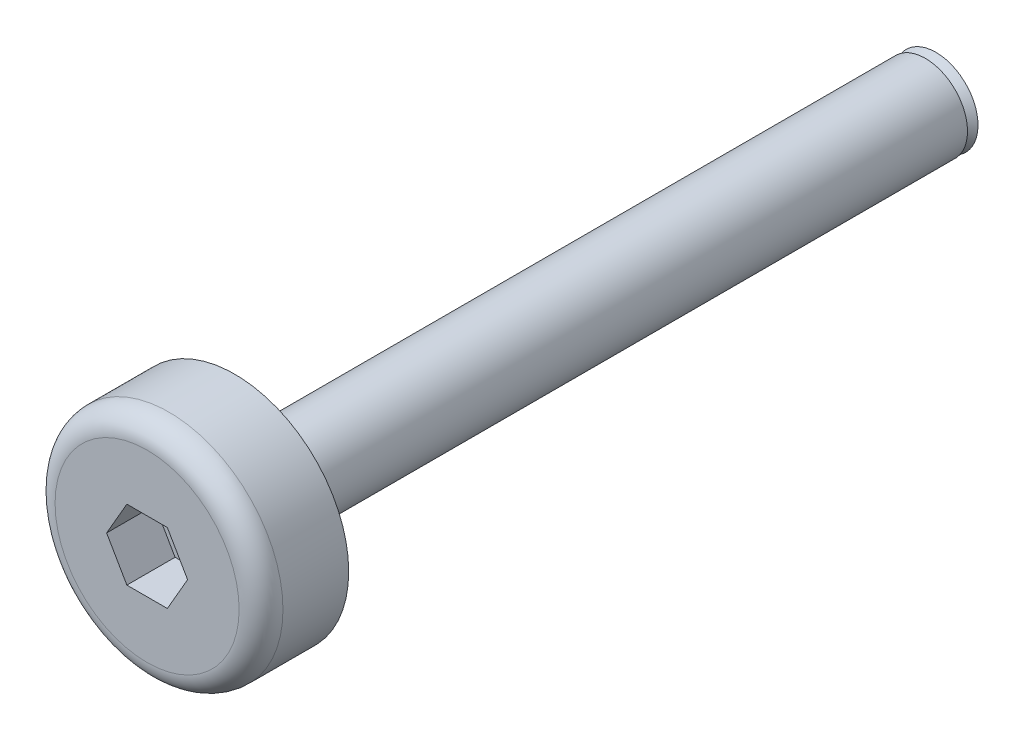
from build123d import *

# Parameters (mm, degrees)
F_0090_CYLINDER_SKETCH_R    = 3.25
F_0090_CYLINDER_DEPTH       = 2.5
F_0091_FILLET_R             = 0.625
F_0092_EXTRUDE_DEPTH        = 1.385
F_0092_EXTRUDE_ROTATE_ANGLE = 120
F_0095_CYLINDER_SKETCH_R    = 1.2
F_0095_CYLINDER_DEPTH       = 19.7
F_0096_CONE_ROTATE_ANGLE    = 90


with BuildPart() as part:
    # 0090_cylinder_Sketch → 0090_cylinder (new body)
    with BuildSketch(Plane.XY):
        Circle(F_0090_CYLINDER_SKETCH_R)
    extrude(amount=F_0090_CYLINDER_DEPTH)

    # 0091_fillet
    f_0091_fillet_edges = [part.edges().sort_by_distance(p)[0] for p in [
        (-3.25, 0, 2.5),
    ]]
    fillet(f_0091_fillet_edges, radius=F_0091_FILLET_R)


with BuildPart() as body_2:
    # 0092_extrude_Sketch → 0092_extrude (new body)
    with BuildSketch(Plane.XY):
        Polygon((0, 0), (1.154700538, 0), (1.732050808, 1), (1.154700538, 2), (0, 2), (-0.577350269, 1), align=None)
    extrude(amount=F_0092_EXTRUDE_DEPTH)


with BuildPart() as body_2_1:
    # 0092_extrude_Rotate: read off the stored shape, not the designer's step
    # 0092_extrude_Rotate: moved
    add(body_2.part.rotate(Axis((0, 0, 0), (0, 0, 1)), F_0092_EXTRUDE_ROTATE_ANGLE))


with BuildPart() as body_2_2:
    # 0092_extrude_Translate: moved
    add(body_2_1.part.moved(Location((1.154700538, 0, 1.125))))


with BuildPart() as part_1:
    add(part.part)

    # 0094_sub: cut body 2
    add(body_2_2.part, mode=Mode.SUBTRACT)


with BuildPart() as body_2_2_1:
    # 0095_cylinder_Sketch → 0095_cylinder (new body)
    with BuildSketch(Plane.XY):
        Circle(F_0095_CYLINDER_SKETCH_R)
    extrude(amount=F_0095_CYLINDER_DEPTH)


with BuildPart() as body_2_2_2:
    # 0095_cylinder_Translate: moved
    add(body_2_2_1.part.moved(Location((0, 0, -19.7))))


with BuildPart() as body_3:
    # 0096_cone_Sketch → 0096_cone (revolve)
    with BuildSketch(Plane.XY, mode=Mode.PRIVATE) as f_0096_cone_sk:
        Polygon((0, 0), (1.2, 0), (0.9, 0.3), (0, 0.3), align=None)
    revolve(f_0096_cone_sk.sketch.rotate(Axis((0, -100, 0), (0, 1, 0)), 90), axis=Axis((0, -100, 0), (0, 1, 0)))


with BuildPart() as body_3_1:
    # 0096_cone_Rotate: moved
    add(body_3.part.rotate(Axis((0, 0, 0), (1, 0, 0)), F_0096_CONE_ROTATE_ANGLE))


with BuildPart() as body_3_2:
    # 0096_cone_Translate: moved
    add(body_3_1.part.moved(Location((0, 0, -20))))


with BuildPart() as body_2_2_3:
    add(body_2_2_2.part)

    # 0098_add: union body 3
    add(body_3_2.part)


with BuildPart() as part_2:
    add(part_1.part)

    # 0099_add: union body 2 2
    add(body_2_2_3.part)


solid = part_2.part
